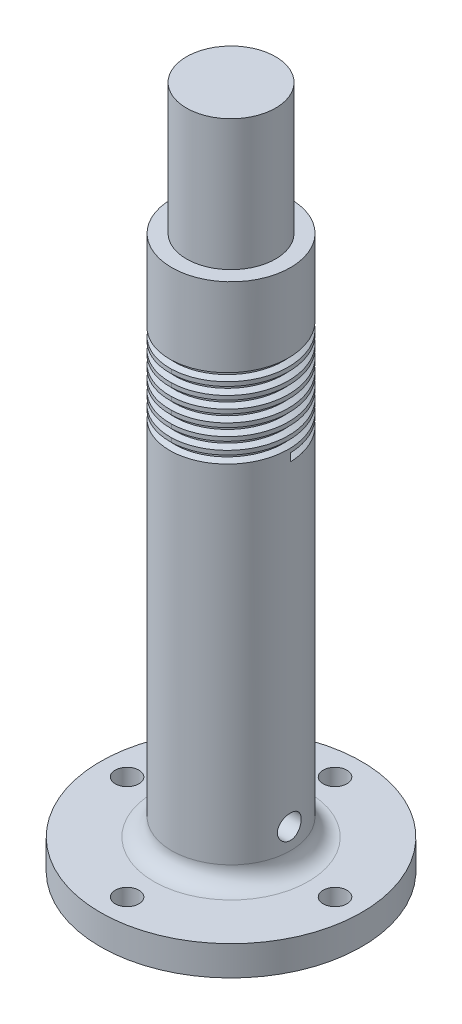
from build123d import *

# Parameters (mm, degrees)
SKETCH1_R               = 22
SKETCH1_R_2             = 2
BOSS_EXTRUDE1_DEPTH     = 5
SKETCH2_R               = 10
BOSS_EXTRUDE2_DEPTH     = 160
FILLET1_R               = 3
SKETCH3_R               = 2
CUT_EXTRUDE1_DEPTH      = 50
CUT_EXTRUDE2_DEPTH      = 100
CUT_EXTRUDE2_DEPTH_BACK = 12
SKETCH7_R               = 10
SKETCH7_R_2             = 7.5
THREAD1_PITCH           = 2
SKETCH12_R              = 7.5
CUT_EXTRUDE4_DEPTH      = 50


with BuildPart() as part:
    # Sketch1 → Boss-Extrude1 (new body)
    with BuildSketch(Plane(origin=(0, 0, 0), x_dir=(1, 0, 0), z_dir=(0, 1, 0))):
        with Locations(Location((0, 0, 0), (0, 0, 270))):
            Circle(SKETCH1_R)
        with Locations(Location((0, 17.5, 0), (0, 0, 270))):
            Circle(SKETCH1_R_2, mode=Mode.SUBTRACT)
        with Locations(Location((17.5, 0, 0), (0, 0, 270))):
            Circle(SKETCH1_R_2, mode=Mode.SUBTRACT)
        with Locations(Location((0, -17.5, 0), (0, 0, 270))):
            Circle(SKETCH1_R_2, mode=Mode.SUBTRACT)
        with Locations(Location((-17.5, 0, 0), (0, 0, 270))):
            Circle(SKETCH1_R_2, mode=Mode.SUBTRACT)
    extrude(amount=BOSS_EXTRUDE1_DEPTH)

    # Sketch2 → Boss-Extrude2 (add)
    with BuildSketch(Plane(origin=(0, 5, 0), x_dir=(1, 0, 0), z_dir=(0, 1, 0))):
        with Locations(Location((0, 0, 0), (0, 0, 270))):
            Circle(SKETCH2_R)
    extrude(amount=BOSS_EXTRUDE2_DEPTH)

    # Fillet1
    fillet1_edges = [part.edges().sort_by_distance(p)[0] for p in [
        (0, 5, -10),
    ]]
    fillet(fillet1_edges, radius=FILLET1_R)

    # Sketch3 → Cut-Extrude1 (cut, symmetric)
    with BuildSketch(Plane(origin=(0, 0, 0), x_dir=(0, 0, -1), z_dir=(1, 0, 0))):
        with Locations((0, 11.5)):
            Circle(SKETCH3_R)
    extrude(amount=CUT_EXTRUDE1_DEPTH, both=True, mode=Mode.SUBTRACT)

    # Sketch7 → Cut-Extrude2 (cut, two sides: drawn at the far end of the back side and taken through both)
    with BuildSketch(Plane(origin=(0, 105, 0), x_dir=(1, 0, 0), z_dir=(0, 1, 0)).offset(-CUT_EXTRUDE2_DEPTH_BACK)):
        with Locations(Location((0, 0, 0), (0, 0, 270))):
            Circle(SKETCH7_R)
        with Locations(Location((0, 0, 0), (0, 0, 270))):
            Circle(SKETCH7_R_2, mode=Mode.SUBTRACT)
    extrude(amount=CUT_EXTRUDE2_DEPTH + CUT_EXTRUDE2_DEPTH_BACK, mode=Mode.SUBTRACT)

    # Thread1: the profile of Thread Profile2 profile screwed along a right-hand helix of 7.5 turns, 10 arcs to a turn; built about Z, then put on its axis
    thread1_z = Axis((0, 0, 0), (0, 0, 1))
    thread1_corners = [(10.0003, 0, -0.000173205), (10.0003, 0, 1.312673201), (9.188101187, 0, 0.843749998), (9.188101187, 0, 0.468749998)]
    with BuildLine(mode=Mode.PRIVATE) as thread1_profile:
        Line(thread1_corners[0], thread1_corners[1])
        Line(thread1_corners[1], thread1_corners[2])
        Line(thread1_corners[2], thread1_corners[3])
        Line(thread1_corners[3], thread1_corners[0])
    thread1_cap = Face(thread1_profile.wire())
    thread1_turn_angles = [0, 18, 36, 54, 72, 90, 108, 126, 144, 162, 180, 198, 216, 234, 252, 270, 288, 306, 324, 342, 360]
    thread1_turn_weights = [1, 0.9510565162951535, 1, 0.9510565162951535, 1, 0.9510565162951535, 1, 0.9510565162951535, 1, 0.9510565162951535, 1, 0.9510565162951535, 1, 0.9510565162951535, 1, 0.9510565162951535, 1, 0.9510565162951535, 1, 0.9510565162951535, 1]
    thread1_turn_rails = [Edge.make_bspline([Vector(p[0], p[1], 0).rotate(thread1_z, thread1_turn_angles[k]) / thread1_turn_weights[k] + Vector(0, 0, p[2] + THREAD1_PITCH * thread1_turn_angles[k] / 360) for k in range(21)], [0, 0, 0, 1, 1, 2, 2, 3, 3, 4, 4, 5, 5, 6, 6, 7, 7, 8, 8, 9, 9, 10, 10, 10], 2, thread1_turn_weights) for p in thread1_corners]
    thread1_turn_sides = [Face.make_surface_from_curves(thread1_turn_rails[p[0]], thread1_turn_rails[p[1]]) for p in [(0, 1), (1, 2), (2, 3), (3, 0)]]
    thread1_last_angles = [2520, 2538, 2556, 2574, 2592, 2610, 2628, 2646, 2664, 2682, 2700]
    thread1_last_weights = [1, 0.9510565162951535, 1, 0.9510565162951535, 1, 0.9510565162951535, 1, 0.9510565162951535, 1, 0.9510565162951535, 1]
    thread1_last_rails = [Edge.make_bspline([Vector(p[0], p[1], 0).rotate(thread1_z, thread1_last_angles[k]) / thread1_last_weights[k] + Vector(0, 0, p[2] + THREAD1_PITCH * thread1_last_angles[k] / 360) for k in range(11)], [0, 0, 0, 1, 1, 2, 2, 3, 3, 4, 4, 5, 5, 5], 2, thread1_last_weights) for p in thread1_corners]
    thread1_last_sides = [Face.make_surface_from_curves(thread1_last_rails[p[0]], thread1_last_rails[p[1]]) for p in [(0, 1), (1, 2), (2, 3), (3, 0)]]
    thread1 = Plane(origin=(0, 81, 0), x_dir=(-1, 0, 0), z_dir=(0, -1, 0)) * Solid(Shell([*[p.moved(Location((0, 0, THREAD1_PITCH * i))) for i in range(7) for p in thread1_turn_sides], *thread1_last_sides, thread1_cap, thread1_cap.rotate(thread1_z, 2700).moved(Location((0, 0, THREAD1_PITCH * 2700 / 360)))]))
    add(thread1, mode=Mode.SUBTRACT)

    # Sketch12 → Cut-Extrude4 (cut)
    with BuildSketch(Plane(origin=(0, 165, 0), x_dir=(1, 0, 0), z_dir=(0, 1, 0))):
        with Locations(Location((0, 0, 0), (0, 0, 270))):
            Circle(SKETCH12_R)
    extrude(amount=-CUT_EXTRUDE4_DEPTH, mode=Mode.SUBTRACT)


solid = part.part
